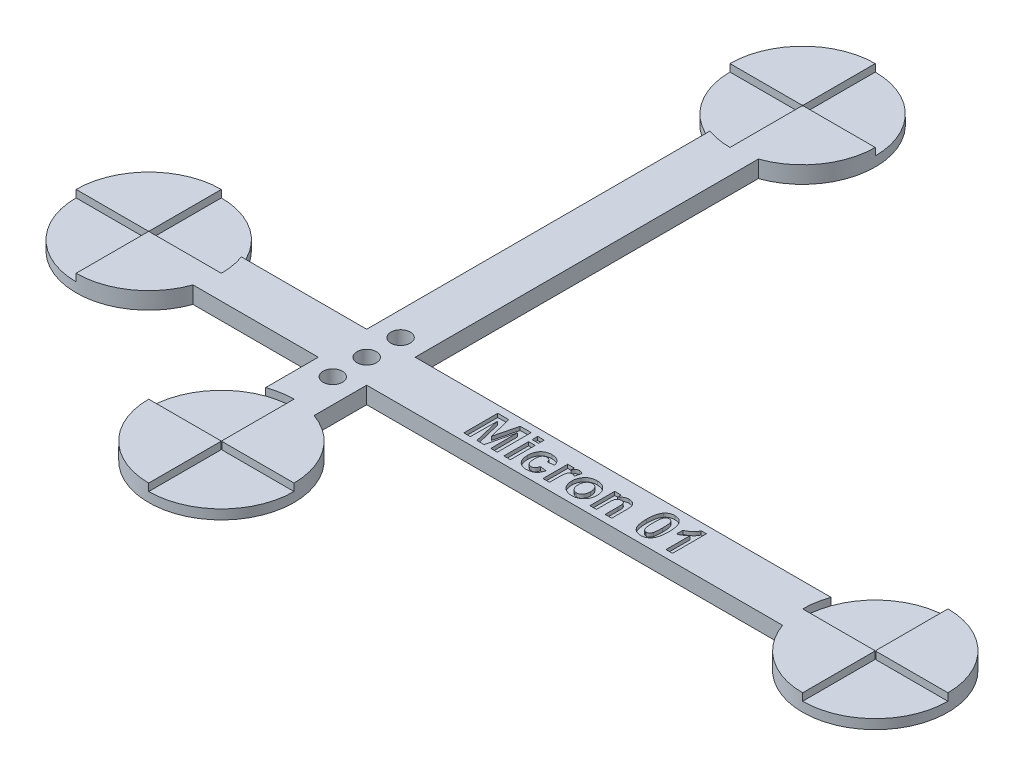
from build123d import *

# Parameters (mm, degrees)
BOSS_EXTRUDE1_DEPTH = 3.5
CUT_EXTRUDE1_START  = -1.52
CUT_EXTRUDE1_DEPTH  = 1.52
SKETCH3_R           = 2
CUT_EXTRUDE2_DEPTH  = 196.607387386
SKETCH5_W           = 1.346153846
SKETCH5_H           = 1.166666667
SKETCH5_H_2         = 5.115384615
CUT_EXTRUDE3_DEPTH  = 0.75


with BuildPart() as part:
    # Sketch1 → Boss-Extrude1 (new body)
    with BuildSketch(Plane(origin=(0, 0, 0), x_dir=(1, 0, 0), z_dir=(0, 1, 0))):
        with BuildLine():
            Line((40, 75.857864376), (40, 5))
            Line((40, 5), (14.142135624, 5))
            ThreePointArc((14.142135624, 5), (-15, 0), (14.142135624, -5))
            Line((14.142135624, -5), (40, -5))
            Line((40, -5), (40, -15.857864376))
            ThreePointArc((40, -15.857864376), (45, -45), (50, -15.857864376))
            Line((50, -15.857864376), (50, -5))
            Line((50, -5), (135.857864376, -5))
            ThreePointArc((135.857864376, -5), (165, 0), (135.857864376, 5))
            Line((135.857864376, 5), (50, 5))
            Line((50, 5), (50, 75.857864376))
            ThreePointArc((50, 75.857864376), (45, 105), (40, 75.857864376))
        make_face()
    extrude(amount=BOSS_EXTRUDE1_DEPTH)

    # Sketch2 → Cut-Extrude1 (cut)
    with BuildSketch(Plane(origin=(0, 3.5, 0), x_dir=(1, 0, 0), z_dir=(0, 1, 0)).offset(CUT_EXTRUDE1_START)):
        with BuildLine():
            Line((45, -45), (45, -30.1))
            ThreePointArc((45, -30.1), (44.929289322, -30.070710678), (44.9, -30))
            Line((44.9, -30), (30, -30))
            ThreePointArc((30, -30), (34.393398282, -19.393398282), (45, -15))
            Line((45, -15), (45, -29.9))
            ThreePointArc((45, -29.9), (45.070710678, -29.929289322), (45.1, -30))
            Line((45.1, -30), (60, -30))
            ThreePointArc((60, -30), (55.606601718, -40.606601718), (45, -45))
        make_face()
        with BuildLine():
            Line((-15, 0), (-0.1, 0))
            ThreePointArc((-0.1, 0), (-0.070710678, 0.070710678), (0, 0.1))
            Line((0, 0.1), (0, 15))
            ThreePointArc((0, 15), (10.606601718, 10.606601718), (15, 0))
            Line((15, 0), (0.1, 0))
            ThreePointArc((0.1, 0), (0.070710678, -0.070710678), (0, -0.1))
            Line((0, -0.1), (0, -15))
            ThreePointArc((0, -15), (-10.606601718, -10.606601718), (-15, 0))
        make_face()
        with BuildLine():
            Line((30, 90), (44.9, 90))
            ThreePointArc((44.9, 90), (44.929289322, 90.070710678), (45, 90.1))
            Line((45, 90.1), (45, 105))
            ThreePointArc((45, 105), (55.606601718, 100.606601718), (60, 90))
            Line((60, 90), (45.1, 90))
            ThreePointArc((45.1, 90), (45.070710678, 89.929289322), (45, 89.9))
            Line((45, 89.9), (45, 75))
            ThreePointArc((45, 75), (34.393398282, 79.393398282), (30, 90))
        make_face()
        with BuildLine():
            Line((150, 15), (150, 0.1))
            ThreePointArc((150, 0.1), (150.070710678, 0.070710678), (150.1, 0))
            Line((150.1, 0), (165, 0))
            ThreePointArc((165, 0), (160.606601718, -10.606601718), (150, -15))
            Line((150, -15), (150, -0.1))
            ThreePointArc((150, -0.1), (149.929289322, -0.070710678), (149.9, 0))
            Line((149.9, 0), (135, 0))
            ThreePointArc((135, 0), (139.393398282, 10.606601718), (150, 15))
        make_face()
    extrude(amount=CUT_EXTRUDE1_DEPTH, mode=Mode.SUBTRACT)

    # Sketch3 → Cut-Extrude2 (cut, through all)
    with BuildSketch(Plane(origin=(0, 3.5, 0), x_dir=(1, 0, 0), z_dir=(0, 1, 0))):
        with Locations((45, 0)):
            Circle(SKETCH3_R)
        with Locations((45, 7)):
            Circle(SKETCH3_R)
        with Locations((45, -7)):
            Circle(SKETCH3_R)
    extrude(amount=-CUT_EXTRUDE2_DEPTH, mode=Mode.SUBTRACT)

    # Sketch5 → Cut-Extrude3 (cut)
    # profile 1 of 9: a face of its own
    with BuildSketch(Plane(origin=(0, 3.5, 0), x_dir=(1, 0, 0), z_dir=(0, 1, 0))):
        Polygon((68.557137316, -3.5), (68.557137316, 3.5), (70.834380906, 3.5), (72.012265521, -1.274639423), (73.190150137, 3.5), (75.467393727, 3.5), (75.467393727, -3.5), (74.12123988, -3.5), (74.076368086, 2.010817308), (72.762465842, -3.5), (71.262065201, -3.5), (69.948162957, 2.010817308), (69.903291162, -3.5), align=None)
    # profile 2 of 9: a face of its own
    with BuildSketch(Plane(origin=(0, 3.5, 0), x_dir=(1, 0, 0), z_dir=(0, 1, 0))):
        with Locations((77.486624496, 2.916666667)):
            Rectangle(SKETCH5_W, SKETCH5_H)
    # profile 3 of 9: a face of its own
    with BuildSketch(Plane(origin=(0, 3.5, 0), x_dir=(1, 0, 0), z_dir=(0, 1, 0))):
        with Locations((77.486624496, -0.942307692)):
            Rectangle(SKETCH5_W, SKETCH5_H_2)
    # profile 4 of 9: a face of its own
    with BuildSketch(Plane(origin=(0, 3.5, 0), x_dir=(1, 0, 0), z_dir=(0, 1, 0))):
        with BuildLine():
            Line((83.723803983, 0.08974359), (82.377650137, -0.08974359))
            add(Edge.make_bspline(
                [(82.377650137, -0.08974359), (82.365277654, -0.026702881), (82.341673882, 0.09356389), (82.281826173, 0.260113107), (82.199974577, 0.401670835), (82.097611893, 0.51732494), (81.97712351, 0.607450251), (81.840268759, 0.673171422), (81.685581657, 0.711401306), (81.577185865, 0.715710363), (81.520879304, 0.717948718)],
                knots=[0, 0, 0, 0, 1.183520367, 2.2578771, 3.246797608, 4.180863388, 5.085846032, 6.003342148, 6.962829327, 8, 8, 8, 8], degree=3))
            add(Edge.make_bspline(
                [(81.520879304, 0.717948718), (81.482498221, 0.716894897), (81.407684642, 0.714840756), (81.298251479, 0.698098117), (81.195737937, 0.667745464), (81.097523133, 0.629114343), (81.006836345, 0.576495155), (80.920991012, 0.514299213), (80.842675236, 0.439090326), (80.769257744, 0.353129964), (80.701753909, 0.253995306), (80.647051205, 0.137976859), (80.599085607, 0.00804074), (80.560102543, -0.137503523), (80.530047591, -0.298346655), (80.507427047, -0.474341951), (80.495339603, -0.665426066), (80.493822197, -0.797860734), (80.493034752, -0.866586538)],
                knots=[0, 0, 0, 0, 0.862078219, 1.680389174, 2.478024961, 3.259954283, 4.04533088, 4.826625376, 5.636266677, 6.477958853, 7.363321064, 8.321359119, 9.351280941, 10.472100686, 11.701575432, 13.024867311, 14.456081111, 16, 16, 16, 16], degree=3))
            add(Edge.make_bspline(
                [(80.493034752, -0.866586538), (80.493639899, -0.942801282), (80.494806774, -1.089762544), (80.509341595, -1.301712899), (80.531002417, -1.496036651), (80.561525189, -1.673267835), (80.601624875, -1.832782613), (80.650795425, -1.975411342), (80.707047794, -2.101633999), (80.776070584, -2.209065714), (80.850031931, -2.303056702), (80.933314865, -2.381466575), (81.019308158, -2.451942196), (81.114884123, -2.505825956), (81.214352737, -2.550853781), (81.321603773, -2.578852356), (81.433547011, -2.60039896), (81.510950539, -2.601834056), (81.550326419, -2.602564103)],
                knots=[0, 0, 0, 0, 1.594318435, 3.074248329, 4.44256617, 5.683784585, 6.834147545, 7.879495874, 8.83778105, 9.716843238, 10.544636748, 11.333080285, 12.105903466, 12.864046512, 13.621684801, 14.38335177, 15.177596319, 16, 16, 16, 16], degree=3))
            add(Edge.make_bspline(
                [(81.550326419, -2.602564103), (81.608100413, -2.600080116), (81.720157046, -2.595262252), (81.879276685, -2.552096012), (82.022202191, -2.482192159), (82.125844391, -2.400004579), (82.201111917, -2.320853296), (82.250138108, -2.247946339), (82.299458931, -2.168177702), (82.339930185, -2.075871785), (82.380235919, -1.975436952), (82.412480151, -1.86369039), (82.444507148, -1.743466381), (82.459601538, -1.65899259), (82.467393727, -1.615384615)],
                knots=[0, 0, 0, 0, 1.391704634, 2.699306801, 3.945045311, 5.206156062, 5.868460975, 6.572467336, 7.320954464, 8.128297893, 8.999513781, 9.930638866, 10.931732014, 12, 12, 12, 12], degree=3))
            Line((82.467393727, -1.615384615), (83.813547573, -1.794871795))
            add(Edge.make_bspline(
                [(83.813547573, -1.794871795), (83.795825896, -1.866656924), (83.76109447, -2.007343377), (83.693590707, -2.209373129), (83.61479608, -2.39820651), (83.525624874, -2.574376956), (83.422745577, -2.73598165), (83.309013151, -2.88413537), (83.183178776, -3.017960811), (83.046861568, -3.139555075), (82.897935718, -3.246410319), (82.736172899, -3.337665389), (82.563936639, -3.416820643), (82.378388792, -3.479144939), (82.181836268, -3.530502493), (81.972413371, -3.564327421), (81.751309208, -3.58604953), (81.599927011, -3.588491221), (81.522281547, -3.58974359)],
                knots=[0, 0, 0, 0, 1.110268429, 2.175934317, 3.195555169, 4.181481111, 5.137790904, 6.068820232, 6.982751273, 7.892872169, 8.808581235, 9.729898078, 10.678730826, 11.651191499, 12.666063818, 13.726769105, 14.834036833, 16, 16, 16, 16], degree=3))
            add(Edge.make_bspline(
                [(81.522281547, -3.58974359), (81.433837068, -3.587598112), (81.261478322, -3.583417051), (81.009756242, -3.550566524), (80.771780691, -3.496564037), (80.547501703, -3.418433664), (80.33596962, -3.32101378), (80.139359833, -3.198661043), (79.956602846, -3.055097693), (79.788125382, -2.890737636), (79.63650412, -2.707369312), (79.505615698, -2.505114604), (79.394554044, -2.286498364), (79.303031081, -2.051298732), (79.233226582, -1.7983952), (79.183681025, -1.529069784), (79.151714713, -1.243154327), (79.148519923, -1.047097203), (79.146880906, -0.946514423)],
                knots=[0, 0, 0, 0, 1.056003706, 2.057917874, 3.026125023, 3.965316587, 4.889355399, 5.801804771, 6.724223409, 7.659808022, 8.607570672, 9.559810849, 10.530974559, 11.531347954, 12.568834288, 13.659317828, 14.799164681, 16, 16, 16, 16], degree=3))
            add(Edge.make_bspline(
                [(79.146880906, -0.946514423), (79.148524185, -0.844997295), (79.151727972, -0.647076357), (79.18360297, -0.358828298), (79.233094763, -0.087580716), (79.30349607, 0.166297338), (79.392466257, 0.40326616), (79.504363423, 0.62183937), (79.635046938, 0.82419118), (79.786794153, 1.007446493), (79.954769379, 1.171954778), (80.138621428, 1.31436025), (80.335702579, 1.436043892), (80.547842096, 1.534147473), (80.773642785, 1.612120293), (81.013992037, 1.665925315), (81.268498667, 1.698802364), (81.442718724, 1.702983298), (81.532097252, 1.705128205)],
                knots=[0, 0, 0, 0, 1.206261992, 2.351765734, 3.442553085, 4.480484798, 5.479315179, 6.445885781, 7.393622348, 8.336902565, 9.26806234, 10.182699256, 11.09556262, 12.0152312, 12.955233282, 13.92969179, 14.937888647, 16, 16, 16, 16], degree=3))
            add(Edge.make_bspline(
                [(81.532097252, 1.705128205), (81.605070142, 1.704384231), (81.747559928, 1.702931518), (81.955377865, 1.681938632), (82.151931544, 1.652324627), (82.3370707, 1.608373074), (82.510877772, 1.55291005), (82.67305557, 1.48425635), (82.822943463, 1.401899226), (82.962440511, 1.308174096), (83.090726225, 1.200105), (83.210447231, 1.080931127), (83.320267383, 0.947732157), (83.421478043, 0.802315403), (83.510713897, 0.64234233), (83.592738582, 0.470830941), (83.663920966, 0.285320122), (83.703546565, 0.155903844), (83.723803983, 0.08974359)],
                knots=[0, 0, 0, 0, 1.178528697, 2.301242291, 3.371523624, 4.388184023, 5.372173667, 6.316227488, 7.228761945, 8.131556558, 9.02696084, 9.934795517, 10.857276148, 11.812560878, 12.793328268, 13.813516901, 14.882225015, 16, 16, 16, 16], degree=3))
        make_face()
    # profile 5 of 9: a face of its own
    with BuildSketch(Plane(origin=(0, 3.5, 0), x_dir=(1, 0, 0), z_dir=(0, 1, 0))):
        with BuildLine():
            Line((86.236624496, -3.5), (84.89047065, -3.5))
            Line((84.89047065, -3.5), (84.89047065, 1.615384615))
            Line((84.89047065, 1.615384615), (86.236624496, 1.615384615))
            Line((86.236624496, 1.615384615), (86.236624496, 0.901642628))
            add(Edge.make_bspline(
                [(86.236624496, 0.901642628), (86.259883743, 0.941904311), (86.304756328, 1.019578614), (86.371134323, 1.130348316), (86.437190473, 1.229067778), (86.502313101, 1.315738052), (86.562695006, 1.393610289), (86.624125097, 1.458290396), (86.681838486, 1.513862665), (86.759057766, 1.569417784), (86.85816177, 1.623638198), (86.982722375, 1.672376349), (87.116123027, 1.699014333), (87.206867798, 1.7030602), (87.253251098, 1.705128205)],
                knots=[0, 0, 0, 0, 1.218987753, 2.351715484, 3.384890168, 4.330893419, 5.1939795, 5.965577503, 6.66790098, 7.29043559, 8.453252551, 9.620708942, 10.783848683, 12, 12, 12, 12], degree=3))
            add(Edge.make_bspline(
                [(87.253251098, 1.705128205), (87.320405095, 1.701358096), (87.455282291, 1.693785921), (87.655090934, 1.639699112), (87.849368018, 1.548142305), (87.969512799, 1.464847397), (88.031496291, 1.421875)],
                knots=[0, 0, 0, 0, 0.956058025, 1.920219652, 2.927027487, 4, 4, 4, 4], degree=3))
            Line((88.031496291, 1.421875), (87.717393727, 0.141626603))
            add(Edge.make_bspline(
                [(87.717393727, 0.141626603), (87.664449803, 0.174925236), (87.563581431, 0.238365546), (87.406138295, 0.305762948), (87.25470486, 0.349888023), (87.154428404, 0.35601587), (87.106015521, 0.358974359)],
                knots=[0, 0, 0, 0, 1.139741959, 2.17142794, 3.117176162, 4, 4, 4, 4], degree=3))
            add(Edge.make_bspline(
                [(87.106015521, 0.358974359), (87.062383442, 0.357110478), (86.977443556, 0.353482004), (86.855168651, 0.324585509), (86.742438401, 0.278028965), (86.638804629, 0.211102954), (86.546124762, 0.117496866), (86.466335118, -0.005816935), (86.399557381, -0.159976511), (86.348517599, -0.309611834), (86.316692358, -0.455051639), (86.294248724, -0.593539742), (86.277196049, -0.759330249), (86.261585532, -0.951920701), (86.251121722, -1.171736755), (86.242884255, -1.418086441), (86.236934639, -1.691545137), (86.236731023, -1.882742337), (86.236624496, -1.982772436)],
                knots=[0, 0, 0, 0, 0.752818562, 1.4655346, 2.15662141, 2.850671748, 3.581264886, 4.414089304, 5.371394652, 6.476667933, 7.138571115, 7.940099809, 8.898357565, 10.015825393, 11.276710544, 12.698206094, 14.272575274, 16, 16, 16, 16], degree=3))
            Line((86.236624496, -1.982772436), (86.236624496, -3.5))
        make_face()
    # profile 6 of 9: a face of its own
    with BuildSketch(Plane(origin=(0, 3.5, 0), x_dir=(1, 0, 0), z_dir=(0, 1, 0))):
        with BuildLine():
            add(Edge.make_bspline(
                [(88.30072706, -0.870793269), (88.305045962, -0.760235903), (88.313692137, -0.538906871), (88.37545065, -0.210134176), (88.479986613, 0.112038713), (88.596998472, 0.373436964), (88.712536167, 0.573274145), (88.805840225, 0.717377785), (88.910004027, 0.850655554), (89.022895624, 0.973952054), (89.141975554, 1.090223099), (89.271436787, 1.195191373), (89.409604934, 1.290665645), (89.555130892, 1.377699163), (89.70780662, 1.45411696), (89.864797668, 1.522044624), (90.026738449, 1.577858255), (90.192500665, 1.624143401), (90.362803099, 1.66126573), (90.537692719, 1.68557028), (90.716957733, 1.701776453), (90.837816813, 1.704000672), (90.899084432, 1.705128205)],
                knots=[0, 0, 0, 0, 1.619840069, 3.242819969, 4.882696853, 6.574901176, 7.427927767, 8.263869039, 9.088735507, 9.903385011, 10.712399333, 11.525463381, 12.34252837, 13.171904741, 14.008210778, 14.842888174, 15.67691885, 16.516221154, 17.363978437, 18.229048737, 19.10224397, 20, 20, 20, 20], degree=3))
            add(Edge.make_bspline(
                [(90.899084432, 1.705128205), (90.992210311, 1.703136544), (91.175407967, 1.69921854), (91.443599, 1.663530133), (91.69856042, 1.604734262), (91.940636298, 1.522866388), (92.170009096, 1.417918164), (92.385525042, 1.287469155), (92.588964705, 1.13534666), (92.776477597, 0.960622814), (92.947873031, 0.769310702), (93.096522834, 0.562484273), (93.223397384, 0.344144411), (93.328477544, 0.113944009), (93.408239879, -0.129331778), (93.463344151, -0.385087436), (93.500243667, -0.652374343), (93.50396088, -0.835142162), (93.505855265, -0.928285256)],
                knots=[0, 0, 0, 0, 1.076054793, 2.116819909, 3.120736197, 4.09633837, 5.065772102, 6.030360709, 7.002891056, 7.996945094, 8.988102315, 9.967288529, 10.93568283, 11.902870597, 12.887008047, 13.888537105, 14.923945207, 16, 16, 16, 16], degree=3))
            add(Edge.make_bspline(
                [(93.505855265, -0.928285256), (93.503953336, -1.022358858), (93.500230128, -1.20651696), (93.463550334, -1.47628572), (93.406832368, -1.734301905), (93.325441844, -1.980042151), (93.220586913, -2.213224526), (93.094263796, -2.434645511), (92.943126034, -2.643140663), (92.770071096, -2.836536926), (92.580135887, -3.012216977), (92.378157233, -3.168393642), (92.161698021, -3.297146595), (91.934555313, -3.405413896), (91.694392155, -3.48757604), (91.442576838, -3.546181121), (91.179301383, -3.58440277), (90.999247208, -3.587940756), (90.907497893, -3.58974359)],
                knots=[0, 0, 0, 0, 1.084306555, 2.122634113, 3.133511532, 4.127271514, 5.10202058, 6.077484774, 7.061903265, 8.065960046, 9.065303363, 10.042062392, 11.004391854, 11.964060687, 12.939122686, 13.924942149, 14.942623041, 16, 16, 16, 16], degree=3))
            add(Edge.make_bspline(
                [(90.907497893, -3.58974359), (90.793197459, -3.585999314), (90.565409876, -3.578537406), (90.228332141, -3.517331391), (89.899580393, -3.418578363), (89.634721788, -3.30491006), (89.432398884, -3.194068459), (89.2889167, -3.100765628), (89.153600151, -3.000634417), (89.029615405, -2.888525117), (88.914822638, -2.767656905), (88.80770116, -2.639200059), (88.712065202, -2.500189519), (88.625243515, -2.353150853), (88.547337372, -2.197033104), (88.482391397, -2.031407384), (88.425965203, -1.858219085), (88.379426741, -1.677074935), (88.344918868, -1.487198195), (88.319828269, -1.289197267), (88.304105213, -1.082783839), (88.301867118, -0.942335777), (88.30072706, -0.870793269)],
                knots=[0, 0, 0, 0, 1.610846835, 3.210231987, 4.81374032, 6.443368681, 7.263437361, 8.06418174, 8.855100662, 9.634539345, 10.417731031, 11.204243685, 11.990424874, 12.794120493, 13.610605693, 14.447765341, 15.300248309, 16.177865431, 17.082777535, 18.019649293, 18.991233806, 20, 20, 20, 20], degree=3))
        make_face()
        with BuildLine():
            add(Edge.make_bspline(
                [(89.646880906, -0.942307692), (89.647878584, -1.007320767), (89.649820064, -1.133836228), (89.667123886, -1.317908247), (89.693943922, -1.490762442), (89.735361519, -1.650791958), (89.785307076, -1.800159307), (89.848707519, -1.936877885), (89.921153825, -2.063536994), (90.007373027, -2.1753987), (90.101343593, -2.274418694), (90.199833871, -2.36240354), (90.303809872, -2.437322036), (90.41391022, -2.49823268), (90.529998823, -2.544473448), (90.650705668, -2.578404662), (90.776898878, -2.59833825), (90.862556349, -2.601139991), (90.90609565, -2.602564103)],
                knots=[0, 0, 0, 0, 1.334287467, 2.596523749, 3.792235791, 4.920928783, 5.98599801, 7.020725633, 8.009778093, 8.975087571, 9.91178927, 10.809031968, 11.682407688, 12.537028737, 13.385161363, 14.241880569, 15.106355953, 16, 16, 16, 16], degree=3))
            add(Edge.make_bspline(
                [(90.90609565, -2.602564103), (90.949636837, -2.601144665), (91.035298021, -2.598352119), (91.161464162, -2.578351489), (91.281853749, -2.544786823), (91.397190506, -2.497854846), (91.507005984, -2.437377328), (91.61091724, -2.362353397), (91.709336483, -2.274781598), (91.802542893, -2.175227372), (91.886267606, -2.061842509), (91.959423839, -1.935578805), (92.022822325, -1.79833688), (92.072998654, -1.64817726), (92.112146338, -1.486306038), (92.139600285, -1.312329148), (92.15676443, -1.126346658), (92.158702325, -0.99843674), (92.159701419, -0.932491987)],
                knots=[0, 0, 0, 0, 0.891374549, 1.753654511, 2.608197993, 3.445305504, 4.297756158, 5.168913853, 6.063877914, 6.991658187, 7.956416983, 8.942957645, 9.975057474, 11.046479855, 12.179282068, 13.381405243, 14.649967197, 16, 16, 16, 16], degree=3))
            add(Edge.make_bspline(
                [(92.159701419, -0.932491987), (92.158697367, -0.867950124), (92.156751088, -0.742840612), (92.139683714, -0.561031756), (92.111771172, -0.390422553), (92.073298945, -0.231185172), (92.022561895, -0.083047614), (91.959026888, 0.052619974), (91.886748624, 0.178516236), (91.80205349, 0.290714614), (91.709395678, 0.390209804), (91.610902071, 0.477726842), (91.507009908, 0.552764833), (91.397189486, 0.61323871), (91.281854027, 0.660171642), (91.161464087, 0.693736048), (91.035298041, 0.713736749), (90.949636844, 0.716529285), (90.90609565, 0.717948718)],
                knots=[0, 0, 0, 0, 1.332105243, 2.582185114, 3.76554119, 4.898206757, 5.96011018, 6.991864232, 7.986448439, 8.951336849, 9.886681577, 10.788942532, 11.667203022, 12.526603947, 13.370536632, 14.232047448, 15.101357822, 16, 16, 16, 16], degree=3))
            add(Edge.make_bspline(
                [(90.90609565, 0.717948718), (90.862556349, 0.716524606), (90.776898878, 0.713722865), (90.650705668, 0.693789278), (90.529998823, 0.659858063), (90.41391022, 0.613617296), (90.303809872, 0.552706651), (90.199833871, 0.477788156), (90.101343593, 0.38980331), (90.007373027, 0.290783316), (89.921153825, 0.17892161), (89.848707519, 0.052262501), (89.785307076, -0.084456078), (89.735361519, -0.233823426), (89.693943922, -0.393852943), (89.667123886, -0.566707137), (89.649820064, -0.750779157), (89.647878584, -0.877294617), (89.646880906, -0.942307692)],
                knots=[0, 0, 0, 0, 0.893644047, 1.758119431, 2.614838637, 3.462971263, 4.317592312, 5.190968032, 6.08821073, 7.024912429, 7.990221907, 8.979274367, 10.01400199, 11.079071217, 12.207764209, 13.403476251, 14.665712533, 16, 16, 16, 16], degree=3))
        make_face(mode=Mode.SUBTRACT)
    # profile 7 of 9: a face of its own
    with BuildSketch(Plane(origin=(0, 3.5, 0), x_dir=(1, 0, 0), z_dir=(0, 1, 0))):
        with BuildLine():
            Line((99.069957829, -3.5), (97.723803983, -3.5))
            Line((97.723803983, -3.5), (97.723803983, -0.875))
            add(Edge.make_bspline(
                [(97.723803983, -0.875), (97.723602692, -0.80862339), (97.723218494, -0.681932094), (97.718527885, -0.50151225), (97.713477967, -0.33926398), (97.705359809, -0.195690673), (97.69420945, -0.069881136), (97.680940928, 0.037381776), (97.664227581, 0.126316058), (97.640514055, 0.219075396), (97.603280694, 0.31750614), (97.542853534, 0.419454306), (97.472803641, 0.509977418), (97.387946168, 0.584030176), (97.292843867, 0.643744945), (97.188425092, 0.687766967), (97.073926815, 0.713473714), (96.994769027, 0.71642676), (96.953972252, 0.717948718)],
                knots=[0, 0, 0, 0, 1.585090075, 3.025419896, 4.30986405, 5.461533023, 6.458985685, 7.325703005, 8.041573048, 8.618245387, 9.611190897, 10.541623111, 11.439410311, 12.333024322, 13.215695708, 14.111259627, 15.026570636, 16, 16, 16, 16], degree=3))
            add(Edge.make_bspline(
                [(96.953972252, 0.717948718), (96.901446439, 0.715341443), (96.798008909, 0.710207014), (96.646127096, 0.674643139), (96.504272122, 0.611656212), (96.371854194, 0.527573319), (96.255091054, 0.423166044), (96.155813236, 0.301229295), (96.077510643, 0.163292863), (96.028725935, 0.034500293), (95.9997776, -0.082074788), (95.980077313, -0.18736516), (95.965963353, -0.310222482), (95.951055688, -0.449397921), (95.942646526, -0.606201002), (95.933263474, -0.779079665), (95.929808832, -0.969405207), (95.929233196, -1.1016966), (95.928932188, -1.170873397)],
                knots=[0, 0, 0, 0, 1.032418065, 2.033110358, 3.045378521, 4.070039643, 5.104744895, 6.110696385, 7.147805894, 8.209255037, 8.806501049, 9.507534436, 10.313289552, 11.236712342, 12.258650821, 13.399345464, 14.640085731, 16, 16, 16, 16], degree=3))
            Line((95.928932188, -1.170873397), (95.928932188, -3.5))
            Line((95.928932188, -3.5), (94.582778342, -3.5))
            Line((94.582778342, -3.5), (94.582778342, 1.615384615))
            Line((94.582778342, 1.615384615), (95.928932188, 1.615384615))
            Line((95.928932188, 1.615384615), (95.928932188, 0.877804487))
            add(Edge.make_bspline(
                [(95.928932188, 0.877804487), (95.980976174, 0.94337945), (96.08236259, 1.07112544), (96.252101926, 1.240902011), (96.431871591, 1.384984638), (96.622482327, 1.502597736), (96.823836354, 1.593383288), (97.035011442, 1.657323362), (97.256181645, 1.698687167), (97.407176778, 1.702955825), (97.484020329, 1.705128205)],
                knots=[0, 0, 0, 0, 1.096260936, 2.135615983, 3.138008533, 4.108575778, 5.062498258, 6.023394349, 6.994077526, 8, 8, 8, 8], degree=3))
            add(Edge.make_bspline(
                [(97.484020329, 1.705128205), (97.551455459, 1.703432581), (97.684254807, 1.700093404), (97.87840855, 1.668042033), (98.063790206, 1.617716821), (98.237815142, 1.547521772), (98.39780225, 1.463814733), (98.538360931, 1.365944084), (98.659178646, 1.258012012), (98.758264399, 1.136836476), (98.838935335, 1.006444736), (98.909151731, 0.869613801), (98.963410859, 0.7231182), (99.005291646, 0.56393665), (99.033684021, 0.383505727), (99.056317805, 0.173923523), (99.067737625, -0.069988674), (99.069186888, -0.243982006), (99.069957829, -0.336538462)],
                knots=[0, 0, 0, 0, 1.087471829, 2.141547729, 3.166311014, 4.181815879, 5.163737, 6.073971965, 6.939083136, 7.769667735, 8.590016746, 9.409741311, 10.247555639, 11.105633939, 12.06171977, 13.192085209, 14.506318385, 16, 16, 16, 16], degree=3))
            Line((99.069957829, -0.336538462), (99.069957829, -3.5))
        make_face()
    # profile 8 of 9: a face of its own
    with BuildSketch(Plane(origin=(0, 3.5, 0), x_dir=(1, 0, 0), z_dir=(0, 1, 0))):
        with BuildLine():
            add(Edge.make_bspline(
                [(105.127650137, 3.5), (105.210973459, 3.497990296), (105.373194416, 3.494077632), (105.609568213, 3.459418509), (105.832125907, 3.403844539), (106.040851165, 3.325286793), (106.235548447, 3.223275021), (106.414920872, 3.097373283), (106.582887972, 2.951355615), (106.679882834, 2.838043484), (106.729012316, 2.780649038)],
                knots=[0, 0, 0, 0, 1.098584764, 2.138818609, 3.143716932, 4.11936356, 5.073598562, 6.034819447, 7.004603936, 8, 8, 8, 8], degree=3))
            add(Edge.make_bspline(
                [(106.729012316, 2.780649038), (106.757115165, 2.744096358), (106.814468155, 2.669498744), (106.89170974, 2.548957239), (106.965967015, 2.421089291), (107.030786368, 2.282817073), (107.092853708, 2.136540065), (107.150372484, 1.981924967), (107.200314244, 1.817694297), (107.24730652, 1.645948025), (107.285600914, 1.464003892), (107.320988477, 1.273826094), (107.350326359, 1.07455247), (107.373461009, 0.866820582), (107.394122544, 0.650946485), (107.405444064, 0.425900053), (107.414713976, 0.192183791), (107.415640415, 0.033196977), (107.416111675, -0.047676282)],
                knots=[0, 0, 0, 0, 0.746761706, 1.524009783, 2.317797294, 3.140957436, 3.996208027, 4.892396322, 5.812273159, 6.776774596, 7.776522781, 8.823794876, 9.910947555, 11.039215469, 12.21036455, 13.424061321, 14.689674014, 16, 16, 16, 16], degree=3))
            add(Edge.make_bspline(
                [(107.416111675, -0.047676282), (107.415647514, -0.128549727), (107.414737711, -0.287069766), (107.405409505, -0.520317147), (107.394112451, -0.744894367), (107.37350921, -0.960779993), (107.350153056, -1.168470585), (107.32165396, -1.36752083), (107.283603433, -1.556824756), (107.245911455, -1.7384787), (107.199194678, -1.910956219), (107.147008626, -2.074892373), (107.09180168, -2.231434895), (107.028291268, -2.377900211), (106.961146178, -2.516343538), (106.887993989, -2.64551665), (106.809889936, -2.766805201), (106.751982092, -2.841796361), (106.723403342, -2.87880609)],
                knots=[0, 0, 0, 0, 1.308387162, 2.564569672, 3.776470597, 4.945886788, 6.07248526, 7.158029334, 8.197718558, 9.195987466, 10.159061779, 11.087054987, 11.979325145, 12.84323098, 13.668471539, 14.467659354, 15.243757377, 16, 16, 16, 16], degree=3))
            add(Edge.make_bspline(
                [(106.723403342, -2.87880609), (106.674723363, -2.935708583), (106.578626735, -3.048036851), (106.412518637, -3.192843578), (106.233443571, -3.316141502), (106.039089218, -3.416126038), (105.831383863, -3.495225841), (105.60846196, -3.549026443), (105.372733911, -3.583756125), (105.210509985, -3.587719301), (105.127650137, -3.58974359)],
                knots=[0, 0, 0, 0, 0.991631672, 1.957528776, 2.911425699, 3.867574088, 4.848108326, 5.850523106, 6.902101959, 8, 8, 8, 8], degree=3))
            add(Edge.make_bspline(
                [(105.127650137, -3.58974359), (105.043843229, -3.587332075), (104.87961925, -3.582606588), (104.639845122, -3.545146301), (104.411928808, -3.485135154), (104.196688524, -3.399455235), (103.99443224, -3.288420347), (103.80357985, -3.155320137), (103.628283527, -2.994127791), (103.491045634, -2.844066609), (103.390641979, -2.708475295), (103.319827907, -2.596038127), (103.251393654, -2.475725869), (103.192326668, -2.343776957), (103.134051837, -2.204094043), (103.08243865, -2.05366677), (103.036902449, -1.893788664), (102.994146853, -1.725189777), (102.958494985, -1.546708789), (102.925700499, -1.358872406), (102.899856676, -1.160881808), (102.876943465, -0.953839776), (102.860811252, -0.737257565), (102.847709837, -0.5114896), (102.841140381, -0.275813207), (102.839847904, -0.115454427), (102.839188598, -0.033653846)],
                knots=[0, 0, 0, 0, 1.257818097, 2.464759732, 3.634271214, 4.790227596, 5.933394726, 7.09190477, 8.274482889, 9.50191983, 10.139172818, 10.805000628, 11.49619854, 12.215266328, 12.973768034, 13.768328009, 14.601232062, 15.469317089, 16.379095881, 17.333267023, 18.331755967, 19.376479622, 20.460535752, 21.592206075, 22.771760786, 24, 24, 24, 24], degree=3))
            add(Edge.make_bspline(
                [(102.839188598, -0.033653846), (102.839649053, 0.046752502), (102.840551486, 0.204338611), (102.849947717, 0.43664665), (102.861095479, 0.6603017), (102.881922973, 0.875695222), (102.904951542, 1.082498955), (102.93397868, 1.280985552), (102.971083155, 1.47012808), (103.011481896, 1.65068144), (103.055796554, 1.823285057), (103.10846774, 1.986496157), (103.163122902, 2.142783223), (103.227375619, 2.288467292), (103.294108477, 2.426619238), (103.367317908, 2.555768146), (103.445407553, 2.677062789), (103.503317262, 2.75205316), (103.531896932, 2.7890625)],
                knots=[0, 0, 0, 0, 1.304469132, 2.556591843, 3.77188756, 4.93702727, 6.066781583, 7.147865049, 8.190466662, 9.19316792, 10.149665317, 11.080258032, 11.975027628, 12.834388201, 13.661940433, 14.463366943, 15.241638981, 16, 16, 16, 16], degree=3))
            add(Edge.make_bspline(
                [(103.531896932, 2.7890625), (103.580574234, 2.845970467), (103.676665577, 2.958309541), (103.842812364, 3.103037161), (104.022085413, 3.226867293), (104.217008558, 3.32565506), (104.424237765, 3.405839286), (104.646867933, 3.45921057), (104.882558423, 3.494031913), (105.044787604, 3.497982262), (105.127650137, 3.5)],
                knots=[0, 0, 0, 0, 0.991667276, 1.957599061, 2.911530233, 3.873218945, 4.847995157, 5.850445929, 6.902062539, 8, 8, 8, 8], degree=3))
        make_face()
        with BuildLine():
            add(Edge.make_bspline(
                [(105.127650137, 2.333333333), (105.08496527, 2.331377346), (105.000530703, 2.327508224), (104.877806939, 2.298834269), (104.761904466, 2.251515994), (104.65226456, 2.185460295), (104.551309982, 2.09356773), (104.46579241, 1.970359526), (104.391937624, 1.819162626), (104.35497736, 1.706149177), (104.335382509, 1.646233974)],
                knots=[0, 0, 0, 0, 0.899391665, 1.779078861, 2.640979247, 3.529945348, 4.464599804, 5.495588918, 6.672261578, 8, 8, 8, 8], degree=3))
            add(Edge.make_bspline(
                [(104.335382509, 1.646233974), (104.323145186, 1.601026296), (104.296843942, 1.503863032), (104.266993122, 1.34544653), (104.242375766, 1.165660571), (104.221588896, 0.964546936), (104.204672766, 0.741999201), (104.19425523, 0.497875761), (104.187054818, 0.232347672), (104.185928426, 0.048149154), (104.185342445, -0.047676282)],
                knots=[0, 0, 0, 0, 0.658986521, 1.416336438, 2.266694271, 3.212608458, 4.261595115, 5.407496572, 6.651304179, 8, 8, 8, 8], degree=3))
            add(Edge.make_bspline(
                [(104.185342445, -0.047676282), (104.186141326, -0.14302767), (104.187672646, -0.32580029), (104.19202109, -0.588135115), (104.204364221, -0.826933735), (104.216718503, -1.043147789), (104.237295105, -1.23609601), (104.257990887, -1.406299418), (104.286516619, -1.552595599), (104.325438332, -1.711718991), (104.384302432, -1.878266865), (104.465062219, -2.04628923), (104.551664335, -2.181203321), (104.6536661, -2.277800907), (104.764061896, -2.342600939), (104.878564469, -2.390212927), (105.001176477, -2.416929723), (105.084994509, -2.421003664), (105.127650137, -2.423076923)],
                knots=[0, 0, 0, 0, 1.613353868, 3.092528792, 4.438413522, 5.658843895, 6.755779493, 7.721003256, 8.558527904, 9.275869043, 10.491421475, 11.538327284, 12.426656321, 13.187490948, 13.890032692, 14.581719216, 15.278226227, 16, 16, 16, 16], degree=3))
            add(Edge.make_bspline(
                [(105.127650137, -2.423076923), (105.1708259, -2.421220141), (105.255319219, -2.417586488), (105.378203772, -2.38795648), (105.494271269, -2.342061023), (105.60317755, -2.274658528), (105.704037572, -2.183395172), (105.789492715, -2.06007625), (105.863367243, -1.908914362), (105.900324505, -1.795895589), (105.919917765, -1.735977564)],
                knots=[0, 0, 0, 0, 0.909107913, 1.77908945, 2.650019014, 3.530482969, 4.465025013, 5.495890128, 6.672421267, 8, 8, 8, 8], degree=3))
            add(Edge.make_bspline(
                [(105.919917765, -1.735977564), (105.932137385, -1.690766299), (105.958280861, -1.594038281), (105.988344392, -1.436607964), (106.013028395, -1.257753647), (106.033617624, -1.05755488), (106.050700146, -0.835487867), (106.061029249, -0.591824852), (106.068236435, -0.326765589), (106.06936967, -0.143034371), (106.069957829, -0.047676282)],
                knots=[0, 0, 0, 0, 0.66114423, 1.414496391, 2.261103113, 3.210114492, 4.255954433, 5.405607896, 6.653488082, 8, 8, 8, 8], degree=3))
            add(Edge.make_bspline(
                [(106.069957829, -0.047676282), (106.070022861, 0.04768509), (106.070147527, 0.230491244), (106.061887947, 0.493159052), (106.05378189, 0.732661087), (106.037252258, 0.948528178), (106.020696375, 1.141489365), (105.996032219, 1.310578558), (105.971185025, 1.457659427), (105.92872111, 1.616451226), (105.871012304, 1.783477729), (105.79217116, 1.953246036), (105.703049418, 2.086895444), (105.601786966, 2.185134457), (105.491934543, 2.251358804), (105.377150964, 2.29911527), (105.254748437, 2.32746093), (105.170327908, 2.331361465), (105.127650137, 2.333333333)],
                knots=[0, 0, 0, 0, 1.611146624, 3.088541111, 4.440175916, 5.659517762, 6.746360572, 7.711365618, 8.546319149, 9.264661039, 10.486047304, 11.528122518, 12.419721574, 13.184982167, 13.89070983, 14.574167459, 15.279187713, 16, 16, 16, 16], degree=3))
        make_face(mode=Mode.SUBTRACT)
    # profile 9 of 9: a face of its own
    with BuildSketch(Plane(origin=(0, 3.5, 0), x_dir=(1, 0, 0), z_dir=(0, 1, 0))):
        with BuildLine():
            Line((111.634060393, -3.5), (110.287906547, -3.5))
            Line((110.287906547, -3.5), (110.287906547, 1.483573718))
            add(Edge.make_bspline(
                [(110.287906547, 1.483573718), (110.226891623, 1.421632188), (110.105689509, 1.298589432), (109.912110638, 1.126961194), (109.711146257, 0.967301681), (109.50080764, 0.821127367), (109.283844448, 0.686355524), (109.058039442, 0.564049557), (108.825029334, 0.452517189), (108.663613143, 0.39018792), (108.582778342, 0.358974359)],
                knots=[0, 0, 0, 0, 1.012567276, 2.011397996, 3.011400399, 4.000747768, 4.993445519, 5.985067596, 6.990952157, 8, 8, 8, 8], degree=3))
            Line((108.582778342, 0.358974359), (108.582778342, 1.705128205))
            add(Edge.make_bspline(
                [(108.582778342, 1.705128205), (108.672428206, 1.738743057), (108.860058395, 1.809096326), (109.136937457, 1.958741297), (109.425936665, 2.144016868), (109.668712498, 2.325729297), (109.861466528, 2.487286169), (109.996186941, 2.617152543), (110.12101315, 2.750142447), (110.231253186, 2.890548307), (110.329800902, 3.035531427), (110.417118475, 3.18485495), (110.49397801, 3.338990581), (110.53421344, 3.446327216), (110.554332829, 3.5)],
                knots=[0, 0, 0, 0, 1.253673617, 2.623841347, 4.114270668, 5.751233548, 6.594491912, 7.409089316, 8.202422231, 8.983165545, 9.746111525, 10.498431446, 11.249153235, 12, 12, 12, 12], degree=3))
            Line((110.554332829, 3.5), (111.634060393, 3.5))
            Line((111.634060393, 3.5), (111.634060393, -3.5))
        make_face()
    extrude(amount=-CUT_EXTRUDE3_DEPTH, mode=Mode.SUBTRACT)


solid = part.part
